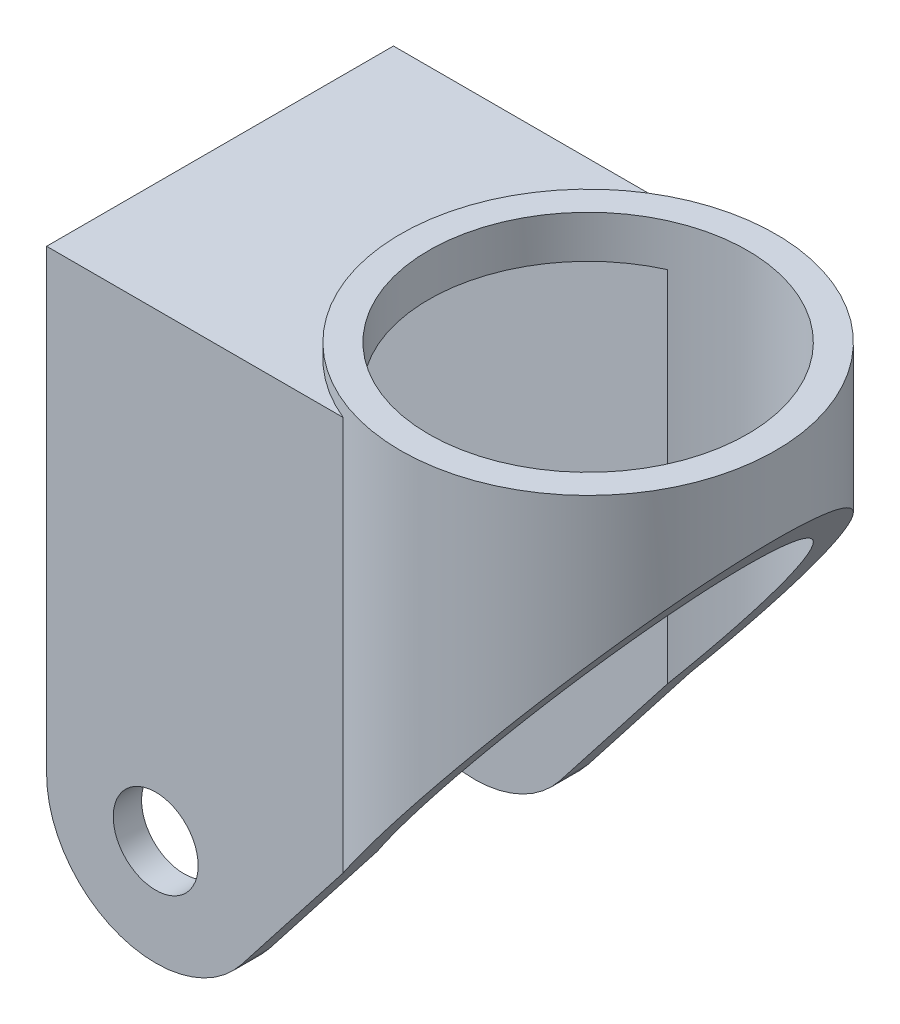
from build123d import *

# Parameters (mm, degrees)
SKETCH1_R               = 26.5
SKETCH1_R_2             = 22.5
BOSS_EXTRUDE1_DEPTH     = 82
SKETCH3_W               = 52
SKETCH3_H               = 49
BOSS_EXTRUDE2_DEPTH     = 80
CUT_EXTRUDE1_DEPTH      = 101.649143066
CUT_EXTRUDE1_DEPTH_BACK = 101.649143066
SHELL1_DEPTH            = 76
CUT_EXTRUDE2_START      = -80
CUT_EXTRUDE2_DEPTH      = 80
FILLET1_R               = 15.409961
FILLET2_R               = 15.409961
SKETCH6_R               = 6
CUT_EXTRUDE3_DEPTH      = 80


# Read off the part's stored shape, not the designer's step: Shell1
with BuildPart() as part:
    # Sketch1 → Boss-Extrude1 (new body)
    with BuildSketch(Plane(origin=(0, 0, 0), x_dir=(1, 0, 0), z_dir=(0, 1, 0))):
        with Locations(Location((0, 0, 0), (0, 0, 270))):
            Circle(SKETCH1_R)
        with Locations(Location((0, 0, 0), (0, 0, 270))):
            Circle(SKETCH1_R_2, mode=Mode.SUBTRACT)
    extrude(amount=BOSS_EXTRUDE1_DEPTH)

    # Sketch3 → Boss-Extrude2 (add)
    with BuildSketch(Plane(origin=(0, 0, 0), x_dir=(1, 0, 0), z_dir=(0, 1, 0))):
        with Locations((-26, 0)):
            Rectangle(SKETCH3_W, SKETCH3_H)
    extrude(amount=BOSS_EXTRUDE2_DEPTH)

    # Sketch4 → Cut-Extrude1 (cut, two sides: drawn at the far end of the back side and taken through both)
    with BuildSketch(Plane.XY.offset(-CUT_EXTRUDE1_DEPTH_BACK)):
        Polygon((163.095245714, 245.965543737), (26.5, 71.131601988), (-29.074098223, 0), (-165.669343938, -174.833941749), (183.998539561, -448.024433177), (512.763129212, -27.224947691), align=None)
    extrude(amount=CUT_EXTRUDE1_DEPTH + CUT_EXTRUDE1_DEPTH_BACK, mode=Mode.SUBTRACT)

    # Shell1 outline → Shell1 (cut)
    with BuildSketch(Plane(origin=(0, 0, 0), x_dir=(1, 0, 0), z_dir=(0, 1, 0))):
        with BuildLine():
            ThreePointArc((-9.273618496, -20.5), (-6.687371777, -21.483227381), (-4, -22.141589825))
            Line((-4, -22.141589825), (-4, 22.141589825))
            ThreePointArc((-4, 22.141589825), (-6.687371776, 21.483227381), (-9.273618495, 20.5))
            Line((-9.273618495, 20.5), (-52, 20.5))
            Line((-52, 20.5), (-52, -20.5))
            Line((-52, -20.5), (-9.273618496, -20.5))
        make_face()
    extrude(amount=SHELL1_DEPTH, mode=Mode.SUBTRACT)

    # Sketch5 → Cut-Extrude2 (cut)
    with BuildSketch(Plane(origin=(0, 80, 0), x_dir=(1, 0, 0), z_dir=(0, 1, 0)).offset(CUT_EXTRUDE2_START)):
        with BuildLine():
            Line((0, -22.5), (0, 22.5))
            ThreePointArc((0, 22.5), (-22.5, 0), (0, -22.5))
        make_face()
    extrude(amount=CUT_EXTRUDE2_DEPTH, mode=Mode.SUBTRACT)

    # Fillet1
    fillet1_edges = [part.edges().sort_by_distance(p)[0] for p in [
        (-52, 0, -22.5),
        (-29.074098223, 0, -22.5),
    ]]
    fillet(fillet1_edges, radius=FILLET1_R)

    # Fillet2
    fillet2_edges = [part.edges().sort_by_distance(p)[0] for p in [
        (-29.074098223, 0, 22.5),
        (-52, 0, 22.5),
    ]]
    fillet(fillet2_edges, radius=FILLET2_R)

    # Sketch6 → Cut-Extrude3 (cut)
    with BuildSketch(Plane.XY.offset(24.5)):
        with Locations((-36.590038591, 14.924477303)):
            Circle(SKETCH6_R)
    extrude(amount=-CUT_EXTRUDE3_DEPTH, mode=Mode.SUBTRACT)


solid = part.part
